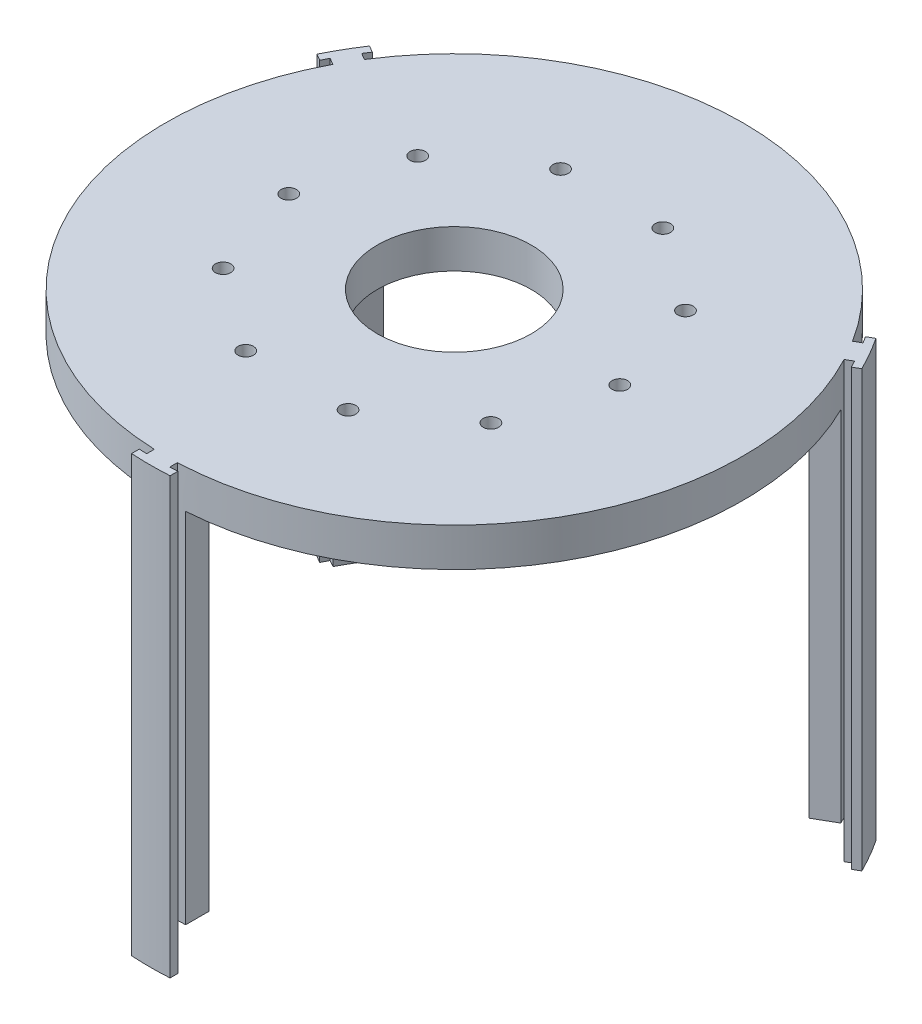
from build123d import *

# Parameters (mm, degrees)
SKETCH1_R           = 37.5
BOSS_EXTRUDE1_DEPTH = 5
CUT_EXTRUDE1_REACH  = 55.268
SKETCH2_R           = 1
BOSS_EXTRUDE2_DEPTH = 46.5
CUT_EXTRUDE2_DEPTH  = 1.6
BOSS_EXTRUDE3_DEPTH = 56.5
CUT_EXTRUDE3_REACH  = 80.478
SKETCH6_R           = 10


with BuildPart() as part:
    # Sketch1 → Boss-Extrude1 (new body)
    with BuildSketch(Plane(origin=(0, 0, 0), x_dir=(1, 0, 0), z_dir=(0, 1, 0))):
        Circle(SKETCH1_R)
    extrude(amount=-BOSS_EXTRUDE1_DEPTH)

    # Sketch2 → Cut-Extrude1 (cut, up to next)
    with BuildSketch(Plane(origin=(0, 0, 0), x_dir=(1, 0, 0), z_dir=(0, 1, 0)), mode=Mode.PRIVATE) as cut_extrude1_sk1:
        with Locations((-21.5, 0)):
            Circle(SKETCH2_R)
    cut_extrude1_tool1 = extrude(cut_extrude1_sk1.sketch, amount=-CUT_EXTRUDE1_REACH, mode=Mode.PRIVATE) & part.part
    # Sketch2 → Cut-Extrude1 (cut, up to next)
    with BuildSketch(Plane(origin=(0, 0, 0), x_dir=(1, 0, 0), z_dir=(0, 1, 0)), mode=Mode.PRIVATE) as cut_extrude1_sk2:
        with Locations((-17.393865379, 12.637382924)):
            Circle(SKETCH2_R)
    cut_extrude1_tool2 = extrude(cut_extrude1_sk2.sketch, amount=-CUT_EXTRUDE1_REACH, mode=Mode.PRIVATE) & part.part
    # Sketch2 → Cut-Extrude1 (cut, up to next)
    with BuildSketch(Plane(origin=(0, 0, 0), x_dir=(1, 0, 0), z_dir=(0, 1, 0)), mode=Mode.PRIVATE) as cut_extrude1_sk3:
        with Locations((-6.643865379, 20.4477151)):
            Circle(SKETCH2_R)
    cut_extrude1_tool3 = extrude(cut_extrude1_sk3.sketch, amount=-CUT_EXTRUDE1_REACH, mode=Mode.PRIVATE) & part.part
    # Sketch2 → Cut-Extrude1 (cut, up to next)
    with BuildSketch(Plane(origin=(0, 0, 0), x_dir=(1, 0, 0), z_dir=(0, 1, 0)), mode=Mode.PRIVATE) as cut_extrude1_sk4:
        with Locations((6.643865379, 20.4477151)):
            Circle(SKETCH2_R)
    cut_extrude1_tool4 = extrude(cut_extrude1_sk4.sketch, amount=-CUT_EXTRUDE1_REACH, mode=Mode.PRIVATE) & part.part
    # Sketch2 → Cut-Extrude1 (cut, up to next)
    with BuildSketch(Plane(origin=(0, 0, 0), x_dir=(1, 0, 0), z_dir=(0, 1, 0)), mode=Mode.PRIVATE) as cut_extrude1_sk5:
        with Locations((17.393865379, 12.637382924)):
            Circle(SKETCH2_R)
    cut_extrude1_tool5 = extrude(cut_extrude1_sk5.sketch, amount=-CUT_EXTRUDE1_REACH, mode=Mode.PRIVATE) & part.part
    # Sketch2 → Cut-Extrude1 (cut, up to next)
    with BuildSketch(Plane(origin=(0, 0, 0), x_dir=(1, 0, 0), z_dir=(0, 1, 0)), mode=Mode.PRIVATE) as cut_extrude1_sk6:
        with Locations((21.5, 0)):
            Circle(SKETCH2_R)
    cut_extrude1_tool6 = extrude(cut_extrude1_sk6.sketch, amount=-CUT_EXTRUDE1_REACH, mode=Mode.PRIVATE) & part.part
    # Sketch2 → Cut-Extrude1 (cut, up to next)
    with BuildSketch(Plane(origin=(0, 0, 0), x_dir=(1, 0, 0), z_dir=(0, 1, 0)), mode=Mode.PRIVATE) as cut_extrude1_sk7:
        with Locations((17.393865379, -12.637382924)):
            Circle(SKETCH2_R)
    cut_extrude1_tool7 = extrude(cut_extrude1_sk7.sketch, amount=-CUT_EXTRUDE1_REACH, mode=Mode.PRIVATE) & part.part
    # Sketch2 → Cut-Extrude1 (cut, up to next)
    with BuildSketch(Plane(origin=(0, 0, 0), x_dir=(1, 0, 0), z_dir=(0, 1, 0)), mode=Mode.PRIVATE) as cut_extrude1_sk8:
        with Locations((6.643865379, -20.4477151)):
            Circle(SKETCH2_R)
    cut_extrude1_tool8 = extrude(cut_extrude1_sk8.sketch, amount=-CUT_EXTRUDE1_REACH, mode=Mode.PRIVATE) & part.part
    # Sketch2 → Cut-Extrude1 (cut, up to next)
    with BuildSketch(Plane(origin=(0, 0, 0), x_dir=(1, 0, 0), z_dir=(0, 1, 0)), mode=Mode.PRIVATE) as cut_extrude1_sk9:
        with Locations((-6.643865379, -20.4477151)):
            Circle(SKETCH2_R)
    cut_extrude1_tool9 = extrude(cut_extrude1_sk9.sketch, amount=-CUT_EXTRUDE1_REACH, mode=Mode.PRIVATE) & part.part
    # Sketch2 → Cut-Extrude1 (cut, up to next)
    with BuildSketch(Plane(origin=(0, 0, 0), x_dir=(1, 0, 0), z_dir=(0, 1, 0)), mode=Mode.PRIVATE) as cut_extrude1_sk10:
        with Locations((-17.393865379, -12.637382924)):
            Circle(SKETCH2_R)
    cut_extrude1_tool10 = extrude(cut_extrude1_sk10.sketch, amount=-CUT_EXTRUDE1_REACH, mode=Mode.PRIVATE) & part.part
    add(cut_extrude1_tool1.solids().sort_by_distance((-21.5, 0, 0))[0], mode=Mode.SUBTRACT)
    add(cut_extrude1_tool2.solids().sort_by_distance((-17.393865, 0, -12.637383))[0], mode=Mode.SUBTRACT)
    add(cut_extrude1_tool3.solids().sort_by_distance((-6.643865, 0, -20.447715))[0], mode=Mode.SUBTRACT)
    add(cut_extrude1_tool4.solids().sort_by_distance((6.643865, 0, -20.447715))[0], mode=Mode.SUBTRACT)
    add(cut_extrude1_tool5.solids().sort_by_distance((17.393865, 0, -12.637383))[0], mode=Mode.SUBTRACT)
    add(cut_extrude1_tool6.solids().sort_by_distance((21.5, 0, 0))[0], mode=Mode.SUBTRACT)
    add(cut_extrude1_tool7.solids().sort_by_distance((17.393865, 0, 12.637383))[0], mode=Mode.SUBTRACT)
    add(cut_extrude1_tool8.solids().sort_by_distance((6.643865, 0, 20.447715))[0], mode=Mode.SUBTRACT)
    add(cut_extrude1_tool9.solids().sort_by_distance((-6.643865, 0, 20.447715))[0], mode=Mode.SUBTRACT)
    add(cut_extrude1_tool10.solids().sort_by_distance((-17.393865, 0, 12.637383))[0], mode=Mode.SUBTRACT)

    # Sketch3 → Boss-Extrude2 (add)
    with BuildSketch(Plane.XZ.offset(5)):
        with BuildLine():
            Line((-2.470466912, 37.418535423), (-2.470466912, 34.414588897))
            Line((-2.470466912, 34.414588897), (2.529533088, 34.414588897))
            Line((2.529533088, 34.414588897), (2.529533088, 37.414588897))
            ThreePointArc((2.529533088, 37.414588897), (0.029598937, 37.499988319), (-2.470466912, 37.418535423))
        make_face()
        with BuildLine():
            Line((33.640635705, -16.569780607), (31.039141702, -15.067807344))
            Line((31.039141702, -15.067807344), (28.539141702, -19.397934363))
            Line((28.539141702, -19.397934363), (31.137217913, -20.897934363))
            ThreePointArc((31.137217913, -20.897934363), (32.461143057, -18.77562759), (33.640635705, -16.569780607))
        make_face()
        with BuildLine():
            Line((-31.170168793, -20.848754817), (-28.56867479, -19.346781554))
            Line((-28.56867479, -19.346781554), (-31.06867479, -15.016654535))
            Line((-31.06867479, -15.016654535), (-33.666751001, -16.516654535))
            ThreePointArc((-33.666751001, -16.516654535), (-32.490741994, -18.724360728), (-31.170168793, -20.848754817))
        make_face()
    extrude(amount=BOSS_EXTRUDE2_DEPTH)

    # Sketch4 → Cut-Extrude2 (cut)
    with BuildSketch(Plane.XZ.offset(5)):
        Polygon((-15.525520661, 11.27995103), (-15.284122516, 13.576700966), (-17.152467233, 14.93413286), (-19.262210097, 13.994814819), (-19.503608243, 11.698064883), (-17.635263525, 10.340632988), align=None)
        Polygon((-19.190598923, 0), (-20.345299462, 2), (-22.654700538, 2), (-23.809401077, 0), (-22.654700538, -2), (-20.345299462, -2), align=None)
        Polygon((-5.9302212, 18.251344158), (-4.384930257, 19.967563618), (-5.098574436, 22.16393456), (-7.357509559, 22.644086043), (-8.902800501, 20.927866583), (-8.189156322, 18.73149564), align=None)
        Polygon((5.9302212, 18.251344158), (8.189156322, 18.73149564), (8.902800501, 20.927866583), (7.357509559, 22.644086043), (5.098574436, 22.16393456), (4.384930257, 19.967563618), align=None)
        Polygon((15.525520661, 11.27995103), (17.635263525, 10.340632988), (19.503608243, 11.698064883), (19.262210097, 13.994814819), (17.152467233, 14.93413286), (15.284122516, 13.576700966), align=None)
        Polygon((19.190598923, 0), (20.345299462, -2), (22.654700538, -2), (23.809401077, 0), (22.654700538, 2), (20.345299462, 2), align=None)
        Polygon((15.525520661, -11.27995103), (15.284122516, -13.576700966), (17.152467233, -14.93413286), (19.262210097, -13.994814819), (19.503608243, -11.698064883), (17.635263525, -10.340632988), align=None)
        Polygon((5.9302212, -18.251344158), (4.384930257, -19.967563618), (5.098574436, -22.16393456), (7.357509559, -22.644086043), (8.902800501, -20.927866583), (8.189156322, -18.73149564), align=None)
        Polygon((-5.9302212, -18.251344158), (-8.189156322, -18.73149564), (-8.902800501, -20.927866583), (-7.357509559, -22.644086043), (-5.098574436, -22.16393456), (-4.384930257, -19.967563618), align=None)
        Polygon((-15.525520661, -11.27995103), (-17.635263525, -10.340632988), (-19.503608243, -11.698064883), (-19.262210097, -13.994814819), (-17.152467233, -14.93413286), (-15.284122516, -13.576700966), align=None)
    extrude(amount=-CUT_EXTRUDE2_DEPTH, mode=Mode.SUBTRACT)

    # Sketch5 → Boss-Extrude3 (add)
    with BuildSketch(Plane(origin=(0, 0, 0), x_dir=(1, 0, 0), z_dir=(0, 1, 0))):
        with BuildLine():
            Line((-2.498164888, -38.416053141), (-2.498164888, -39.420923026))
            ThreePointArc((-2.498164888, -39.420923026), (0.001838798, -39.499999957), (2.501835112, -39.420690266))
            Line((2.501835112, -39.420690266), (2.501835112, -38.415814294))
            ThreePointArc((2.501835112, -38.415814294), (2.002004433, -38.445103004), (1.501835112, -38.467888661))
            Line((1.501835112, -38.467888661), (1.501835112, -37.469914482))
            ThreePointArc((1.501835112, -37.469914482), (0.001839069, -37.499999955), (-1.498159918, -37.470061607))
            Line((-1.498159918, -37.470061607), (-1.498159918, -38.46803197))
            ThreePointArc((-1.498159918, -38.46803197), (-1.998331414, -38.445294099), (-2.498164888, -38.416053141))
        make_face()
        with BuildLine():
            Line((-32.020195489, 21.371500827), (-32.890438337, 21.873935769))
            ThreePointArc((-32.890438337, 21.873935769), (-34.208922812, 19.748407533), (-35.390236761, 17.54369237))
            Line((-35.390236761, 17.54369237), (-34.519988641, 17.041254384))
            ThreePointArc((-34.519988641, 17.041254384), (-34.295438069, 17.488764805), (-34.065086367, 17.933316972))
            Line((-34.065086367, 17.933316972), (-33.200815375, 17.434329882))
            ThreePointArc((-33.200815375, 17.434329882), (-32.476872137, 18.748407297), (-31.700945275, 20.032475351))
            Line((-31.700945275, 20.032475351), (-32.565212961, 20.531460533))
            ThreePointArc((-32.565212961, 20.531460533), (-32.295435639, 20.953252819), (-32.020195489, 21.371500827))
        make_face()
        with BuildLine():
            Line((34.518360378, 17.044552315), (35.388603225, 17.546987257))
            ThreePointArc((35.388603225, 17.546987257), (34.207084013, 19.751592425), (32.888401649, 21.876997896))
            Line((32.888401649, 21.876997896), (32.018153529, 21.37455991))
            ThreePointArc((32.018153529, 21.37455991), (32.293433636, 20.9563382), (32.563251255, 20.53457169))
            Line((32.563251255, 20.53457169), (31.698980263, 20.0355846))
            ThreePointArc((31.698980263, 20.0355846), (32.475033068, 18.751592658), (33.199105192, 17.437586256))
            Line((33.199105192, 17.437586256), (34.063372878, 17.936571437))
            ThreePointArc((34.063372878, 17.936571437), (34.293767052, 17.49204128), (34.518360378, 17.044552315))
        make_face()
    extrude(amount=-BOSS_EXTRUDE3_DEPTH)

    # Sketch6 → Cut-Extrude3 (cut, up to next)
    with BuildSketch(Plane(origin=(0, 0, 0), x_dir=(1, 0, 0), z_dir=(0, 1, 0)), mode=Mode.PRIVATE) as cut_extrude3_sk1:
        Circle(SKETCH6_R)
    cut_extrude3_tool1 = extrude(cut_extrude3_sk1.sketch, amount=-CUT_EXTRUDE3_REACH, mode=Mode.PRIVATE) & part.part
    add(cut_extrude3_tool1.solids().sort_by_distance((0, 0, 0))[0], mode=Mode.SUBTRACT)


solid = part.part
